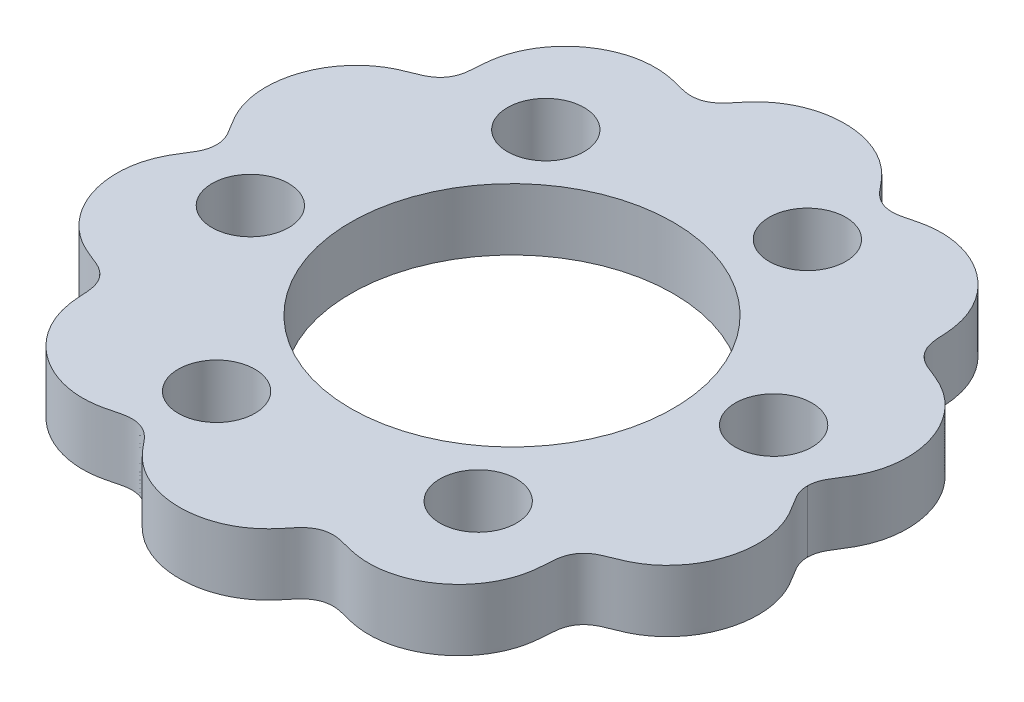
from build123d import *

# Parameters (mm, degrees)
BOSS_EXTRUDE1_DEPTH = 5
SKETCH2_R           = 13.05
CUT_EXTRUDE1_DEPTH  = 38.707841393
SKETCH3_R           = 3.1
CUT_EXTRUDE2_DEPTH  = 38.707841393
CIRPATTERN1_COUNT   = 6


with BuildPart() as part:
    # Sketch1 → Boss-Extrude1 (new body)
    with BuildSketch(Plane(origin=(0, 0, 0), x_dir=(1, 0, 0), z_dir=(0, 1, 0))):
        with BuildLine():
            add(Edge.make_bspline(
                [(23.9, 0), (23.9, -0.016633989), (23.900445322, -0.049716738), (23.903117263, -0.135350435), (23.912449323, -0.258275625), (23.931014764, -0.389664583), (23.95950077, -0.532178366), (23.991965599, -0.654750336), (24.032983907, -0.786511172), (24.083782664, -0.924885773), (24.152134694, -1.082987887), (24.242890991, -1.262939392), (24.344653165, -1.442540166), (24.455160863, -1.62253731), (24.571701309, -1.804480724), (24.718332668, -2.031272436), (24.891440754, -2.305276667), (25.08752709, -2.640233385), (25.293354955, -3.042827983), (25.523356461, -3.575365943), (25.743503693, -4.249070037), (25.90895307, -5.060229623), (25.989021701, -6.239979202), (25.864263399, -7.422194916), (25.541810184, -8.56833506), (25.032271071, -9.642344828), (24.515868766, -10.44509368), (23.898825197, -11.173556713), (23.189250761, -11.812425557), (22.506894507, -12.273540648), (21.894123423, -12.592734858), (21.380382876, -12.81286495), (20.981186658, -12.967022062), (20.508286762, -13.149650453), (20.002819314, -13.392358805), (19.516275612, -13.770444983), (19.107135549, -14.342924661), (18.904436986, -14.938672604), (18.837743288, -15.510825887), (18.811680981, -16.040809437), (18.784521574, -16.489892991), (18.724656278, -17.057834998), (18.596613672, -17.739277292), (18.286978104, -18.742891592), (17.634453661, -19.994985608), (16.567681951, -21.268872628), (15.018746131, -22.380373674), (13.232021309, -23.071186796), (11.686263401, -23.233504295), (10.520948657, -23.10721323), (9.745023474, -22.927131672), (9.331355803, -22.817516456), (8.8414507, -22.687628022), (8.289082778, -22.590399027), (7.675024184, -22.615604046), (7.013991426, -22.842464767), (6.507806015, -23.203624322), (6.123760777, -23.620439494), (5.797319915, -24.026122754), (5.516993379, -24.366413103), (4.988653796, -24.957955887), (4.121749015, -25.716255592), (2.800220177, -26.458949577), (0.986584089, -26.932274503), (-0.892508871, -26.944576885), (-2.492684707, -26.549040992), (-3.758629608, -25.923530552), (-4.601197212, -25.296224361), (-5.106881385, -24.821721344), (-5.490331154, -24.398391643), (-5.776848315, -24.051429867), (-6.109234539, -23.637738359), (-6.497134166, -23.211951019), (-7.00800434, -22.844726368), (-7.673409625, -22.615662906), (-8.289091303, -22.590403621), (-8.841445105, -22.687625059), (-9.331358863, -22.817518065), (-9.745022337, -22.927131075), (-10.520949385, -23.107213612), (-11.686262901, -23.233504033), (-13.232021627, -23.071186963), (-15.018745949, -22.380373578), (-16.567682076, -21.268872694), (-17.63445358, -19.994985565), (-18.286978155, -18.742891619), (-18.596613642, -17.739277276), (-18.724656297, -17.057835008), (-18.784521564, -16.489892985), (-18.811680987, -16.04080944), (-18.837743285, -15.510825885), (-18.904436988, -14.938672605), (-19.107135548, -14.34292466), (-19.516275613, -13.770444984), (-20.002819314, -13.392358805), (-20.508286763, -13.149650453), (-20.981186657, -12.967022061), (-21.380382877, -12.81286495), (-21.894123423, -12.592734858), (-22.506894507, -12.273540648), (-23.189250761, -11.812425557), (-23.898825197, -11.173556713), (-24.515868766, -10.44509368), (-25.032271071, -9.642344828), (-25.541810184, -8.56833506), (-25.864263399, -7.422194916), (-25.989021701, -6.239979202), (-25.90895307, -5.060229623), (-25.743503693, -4.249070037), (-25.523356461, -3.575365943), (-25.293354955, -3.042827983), (-25.08752709, -2.640233385), (-24.891440754, -2.305276667), (-24.718332668, -2.031272436), (-24.571701309, -1.804480724), (-24.455160863, -1.62253731), (-24.344653165, -1.442540166), (-24.242890991, -1.262939392), (-24.152134694, -1.082987887), (-24.083782664, -0.924885773), (-24.032983907, -0.786511172), (-23.991965599, -0.654750336), (-23.95950077, -0.532178365), (-23.931014765, -0.389664584), (-23.912449321, -0.258275624), (-23.903117265, -0.135350437), (-23.900445324, -0.049716739), (-23.9, -0.016633989), (-23.9, 0)],
                knots=[0.076870089, 0.076870089, 0.076870089, 0.076870089, 0.076870089, 0.077626864, 0.078383639, 0.079897189, 0.081410739, 0.082924289, 0.083870594, 0.084816898, 0.086709508, 0.088602118, 0.090494728, 0.092574338, 0.094653949, 0.096733559, 0.09881317, 0.102972391, 0.107131612, 0.111670975, 0.116210339, 0.125289066, 0.134368095, 0.143447123, 0.161604528, 0.17076612, 0.179927712, 0.189089676, 0.19825164, 0.207413052, 0.216574463, 0.220692039, 0.224809615, 0.228927191, 0.233044767, 0.240218222, 0.246328137, 0.252327936, 0.259784753, 0.264113126, 0.268441498, 0.27276987, 0.277098243, 0.286093979, 0.295089716, 0.313081822, 0.331073403, 0.349394218, 0.367715837, 0.386036254, 0.390153136, 0.394270018, 0.398386899, 0.402503781, 0.4096773, 0.415786121, 0.421726112, 0.429062853, 0.433304136, 0.43754542, 0.441786703, 0.446027986, 0.463837747, 0.481648122, 0.499457726, 0.517451628, 0.535445968, 0.544442792, 0.553439616, 0.557768563, 0.562097511, 0.566426458, 0.570755406, 0.578212988, 0.584213879, 0.5903227, 0.597496219, 0.601613101, 0.605729982, 0.609846864, 0.613963746, 0.632284163, 0.650605782, 0.668926597, 0.686918178, 0.704910284, 0.713906021, 0.722901757, 0.72723013, 0.731558502, 0.735886874, 0.740215247, 0.747672064, 0.753671863, 0.759781778, 0.766955233, 0.771072809, 0.775190385, 0.779307961, 0.783425537, 0.792586948, 0.80174836, 0.810910324, 0.820072288, 0.82923388, 0.838395472, 0.856552877, 0.865631905, 0.874710934, 0.883789661, 0.888329025, 0.892868388, 0.897027609, 0.90118683, 0.903266441, 0.905346051, 0.907425662, 0.909505272, 0.911397882, 0.913290492, 0.915183102, 0.916129406, 0.917075711, 0.918589261, 0.920102811, 0.921616361, 0.922373136, 0.923129911, 0.923129911, 0.923129911, 0.923129911, 0.923129911], degree=4))
            add(Edge.make_bspline(
                [(-23.9, 0), (-23.9, 0.016633989), (-23.900445322, 0.049716738), (-23.903117263, 0.135350435), (-23.912449323, 0.258275625), (-23.931014764, 0.389664583), (-23.95950077, 0.532178365), (-23.991965599, 0.654750336), (-24.032983907, 0.786511172), (-24.083782664, 0.924885773), (-24.152134694, 1.082987887), (-24.242890991, 1.262939392), (-24.344653165, 1.442540166), (-24.455160863, 1.62253731), (-24.571701309, 1.804480724), (-24.718332668, 2.031272436), (-24.891440754, 2.305276667), (-25.08752709, 2.640233385), (-25.293354955, 3.042827983), (-25.523356461, 3.575365943), (-25.743503693, 4.249070037), (-25.90895307, 5.060229623), (-25.989021701, 6.239979202), (-25.864263399, 7.422194916), (-25.541810184, 8.56833506), (-25.032271071, 9.642344828), (-24.515868766, 10.44509368), (-23.898825197, 11.173556713), (-23.189250761, 11.812425557), (-22.506894507, 12.273540648), (-21.894123423, 12.592734858), (-21.380382876, 12.81286495), (-20.981186658, 12.967022062), (-20.508286762, 13.149650453), (-20.002819314, 13.392358805), (-19.516275612, 13.770444983), (-19.107135549, 14.342924661), (-18.904436986, 14.938672604), (-18.837743288, 15.510825887), (-18.811680981, 16.040809437), (-18.784521574, 16.489892991), (-18.724656278, 17.057834998), (-18.596613672, 17.739277292), (-18.286978104, 18.742891592), (-17.634453661, 19.994985608), (-16.567681951, 21.268872628), (-15.018746131, 22.380373674), (-13.232021309, 23.071186796), (-11.686263401, 23.233504295), (-10.520948657, 23.10721323), (-9.745023474, 22.927131672), (-9.331355803, 22.817516456), (-8.8414507, 22.687628022), (-8.289082778, 22.590399027), (-7.675024184, 22.615604046), (-7.013991426, 22.842464767), (-6.507806015, 23.203624322), (-6.123760777, 23.620439494), (-5.797319915, 24.026122754), (-5.516993379, 24.366413103), (-4.988653796, 24.957955887), (-4.121749015, 25.716255592), (-2.800220177, 26.458949577), (-0.986584089, 26.932274503), (0.892508871, 26.944576885), (2.492684707, 26.549040992), (3.758629608, 25.923530552), (4.601197212, 25.296224361), (5.106881385, 24.821721344), (5.490331154, 24.398391643), (5.776848315, 24.051429867), (6.109234539, 23.637738359), (6.497134166, 23.211951019), (7.00800434, 22.844726368), (7.673409625, 22.615662906), (8.289091303, 22.590403621), (8.841445105, 22.687625059), (9.331358863, 22.817518065), (9.745022337, 22.927131075), (10.520949385, 23.107213612), (11.686262901, 23.233504033), (13.232021627, 23.071186963), (15.018745949, 22.380373578), (16.567682076, 21.268872694), (17.63445358, 19.994985565), (18.286978155, 18.742891619), (18.596613642, 17.739277276), (18.724656297, 17.057835008), (18.784521564, 16.489892985), (18.811680987, 16.04080944), (18.837743285, 15.510825885), (18.904436988, 14.938672605), (19.107135548, 14.34292466), (19.516275613, 13.770444984), (20.002819314, 13.392358805), (20.508286763, 13.149650453), (20.981186657, 12.967022061), (21.380382877, 12.81286495), (21.894123423, 12.592734858), (22.506894507, 12.273540648), (23.189250761, 11.812425557), (23.898825197, 11.173556713), (24.515868766, 10.44509368), (25.032271071, 9.642344828), (25.541810184, 8.56833506), (25.864263399, 7.422194915), (25.989021701, 6.239979203), (25.90895307, 5.060229621), (25.743503693, 4.249070041), (25.523356461, 3.575365937), (25.293354955, 3.042827994), (25.08752709, 2.640233361), (24.891440754, 2.30527671), (24.718332668, 2.031272365), (24.571701309, 1.804480847), (24.455160863, 1.622537048), (24.344653165, 1.442540618), (24.242890991, 1.262938646), (24.152134694, 1.08298926), (24.083782664, 0.92488324), (24.032983907, 0.786515802), (23.991965599, 0.654738614), (23.95950077, 0.53221509), (23.931014764, 0.389575382), (23.912449323, 0.258442601), (23.903117262, 0.135032083), (23.900445327, 0.050068621), (23.9, 0.01663399), (23.9, 0)],
                knots=[0.076870089, 0.076870089, 0.076870089, 0.076870089, 0.076870089, 0.077626864, 0.078383639, 0.079897189, 0.081410739, 0.082924289, 0.083870594, 0.084816898, 0.086709508, 0.088602118, 0.090494728, 0.092574338, 0.094653949, 0.096733559, 0.09881317, 0.102972391, 0.107131612, 0.111670975, 0.116210339, 0.125289066, 0.134368095, 0.143447123, 0.161604528, 0.17076612, 0.179927712, 0.189089676, 0.19825164, 0.207413052, 0.216574463, 0.220692039, 0.224809615, 0.228927191, 0.233044767, 0.240218222, 0.246328137, 0.252327936, 0.259784753, 0.264113126, 0.268441498, 0.27276987, 0.277098243, 0.286093979, 0.295089716, 0.313081822, 0.331073403, 0.349394218, 0.367715837, 0.386036254, 0.390153136, 0.394270018, 0.398386899, 0.402503781, 0.4096773, 0.415786121, 0.421726112, 0.429062853, 0.433304136, 0.43754542, 0.441786703, 0.446027986, 0.463837747, 0.481648122, 0.499457726, 0.517451628, 0.535445968, 0.544442792, 0.553439616, 0.557768563, 0.562097511, 0.566426458, 0.570755406, 0.578212988, 0.584213879, 0.5903227, 0.597496219, 0.601613101, 0.605729982, 0.609846864, 0.613963746, 0.632284163, 0.650605782, 0.668926597, 0.686918178, 0.704910284, 0.713906021, 0.722901757, 0.72723013, 0.731558502, 0.735886874, 0.740215247, 0.747672064, 0.753671863, 0.759781778, 0.766955233, 0.771072809, 0.775190385, 0.779307961, 0.783425537, 0.792586948, 0.80174836, 0.810910324, 0.820072288, 0.82923388, 0.838395472, 0.856552877, 0.865631905, 0.874710934, 0.883789661, 0.888329025, 0.892868388, 0.897027609, 0.90118683, 0.903266441, 0.905346051, 0.907425662, 0.909505272, 0.911397882, 0.913290492, 0.915183102, 0.916129406, 0.917075711, 0.918589261, 0.920102811, 0.921616361, 0.922373136, 0.923129911, 0.923129911, 0.923129911, 0.923129911, 0.923129911], degree=4))
        make_face()
    extrude(amount=BOSS_EXTRUDE1_DEPTH)

    # Sketch2 → Cut-Extrude1 (cut, through all)
    with BuildSketch(Plane(origin=(0, 5, 0), x_dir=(1, 0, 0), z_dir=(0, 1, 0))):
        Circle(SKETCH2_R)
    extrude(amount=-CUT_EXTRUDE1_DEPTH, mode=Mode.SUBTRACT)

    # Sketch3 → Cut-Extrude2 (cut, through all)
    with BuildSketch(Plane(origin=(0, 5, 0), x_dir=(1, 0, 0), z_dir=(0, 1, 0))):
        with Locations((18.272234301, 2.894037603)):
            Circle(SKETCH3_R)
    cut_extrude2 = extrude(amount=-CUT_EXTRUDE2_DEPTH, mode=Mode.SUBTRACT)

    # CirPattern1: Cut-Extrude2 ×6 about axis
    cirpattern1_axis = Axis((0, 5, 0), (0, 1, 0))
    for i in range(1, CIRPATTERN1_COUNT):
        add(cut_extrude2.rotate(cirpattern1_axis, i * 360 / CIRPATTERN1_COUNT), mode=Mode.SUBTRACT)


solid = part.part
